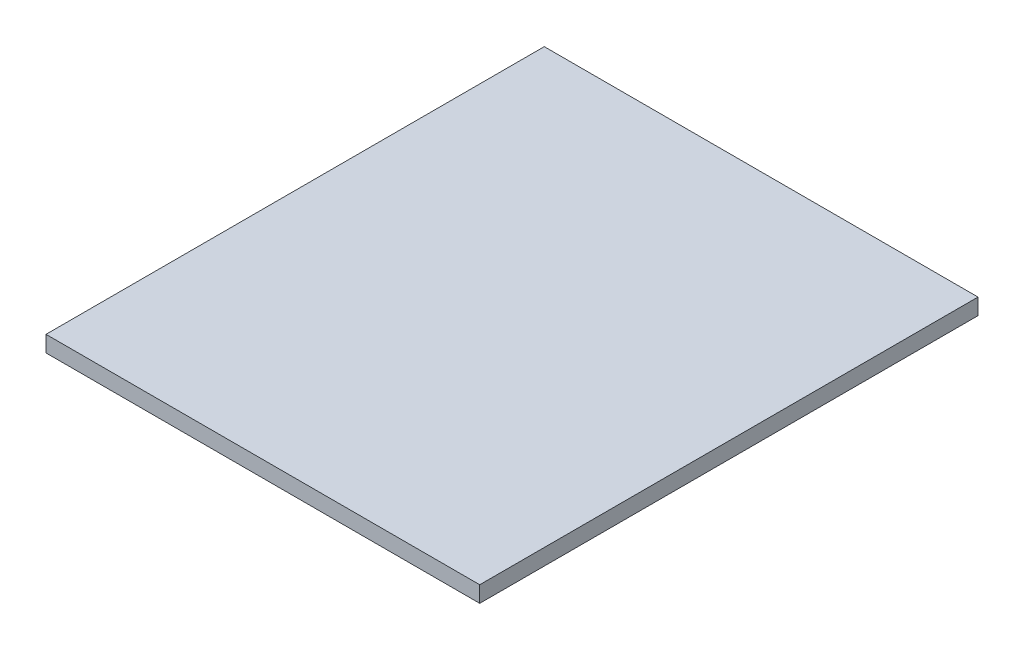
from build123d import *

# Parameters (mm, degrees)
SKETCH1_W           = 86
SKETCH1_H           = 98.8
BOSS_EXTRUDE1_DEPTH = 3.2


with BuildPart() as part:
    # Sketch1 → Boss-Extrude1 (new body)
    with BuildSketch(Plane(origin=(0, 0, 0), x_dir=(1, 0, 0), z_dir=(0, 1, 0))):
        with Locations((-1.281542056, -28.701985981)):
            Rectangle(SKETCH1_W, SKETCH1_H)
    extrude(amount=BOSS_EXTRUDE1_DEPTH)


solid = part.part
